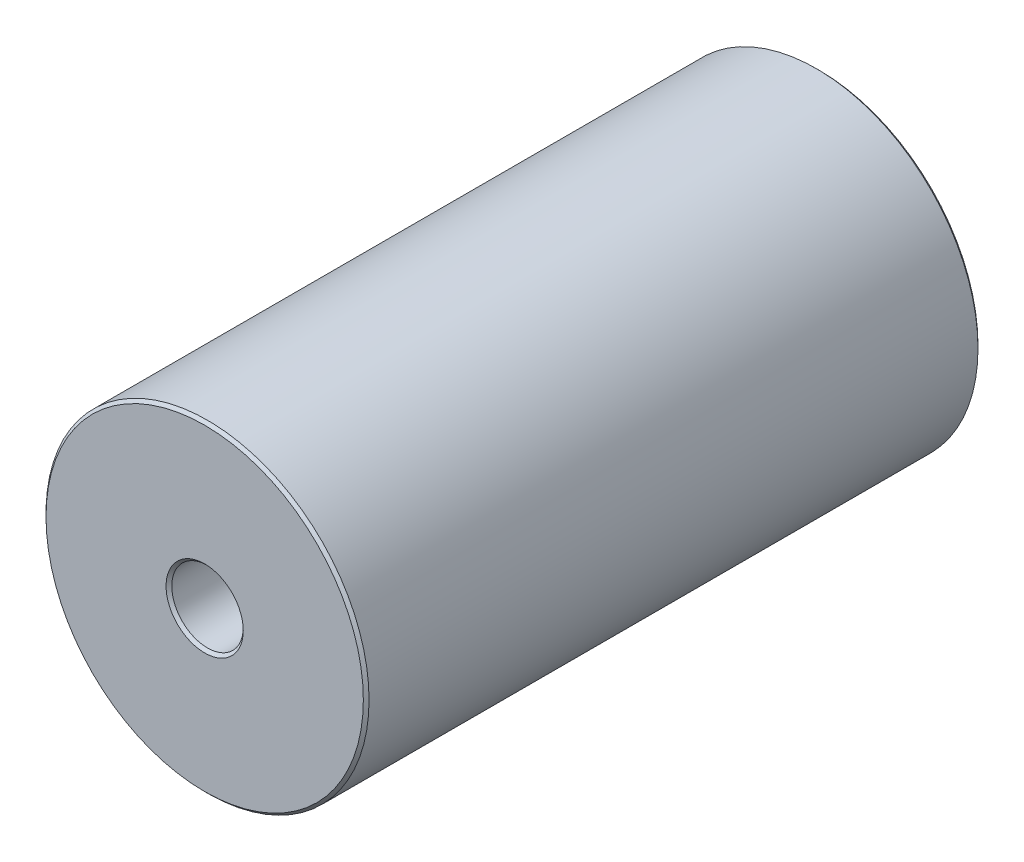
from build123d import *

# Parameters (mm, degrees)
SKETCH1_R           = 14.351
SKETCH1_R_2         = 3.175
BOSS_EXTRUDE1_DEPTH = 54.61
CHAMFER1_SIZE       = 0.254


with BuildPart() as part:
    # Sketch1 → Boss-Extrude1 (new body)
    with BuildSketch(Plane.XY):
        Circle(SKETCH1_R)
        Circle(SKETCH1_R_2, mode=Mode.SUBTRACT)
    extrude(amount=BOSS_EXTRUDE1_DEPTH)

    # Chamfer1
    chamfer1_edges = [part.edges().sort_by_distance(p)[0] for p in [
        (-3.175, 0, 0),
        (-14.351, 0, 0),
        (-3.175, 0, 54.61),
        (-14.351, 0, 54.61),
    ]]
    chamfer(chamfer1_edges, length=CHAMFER1_SIZE)


solid = part.part
